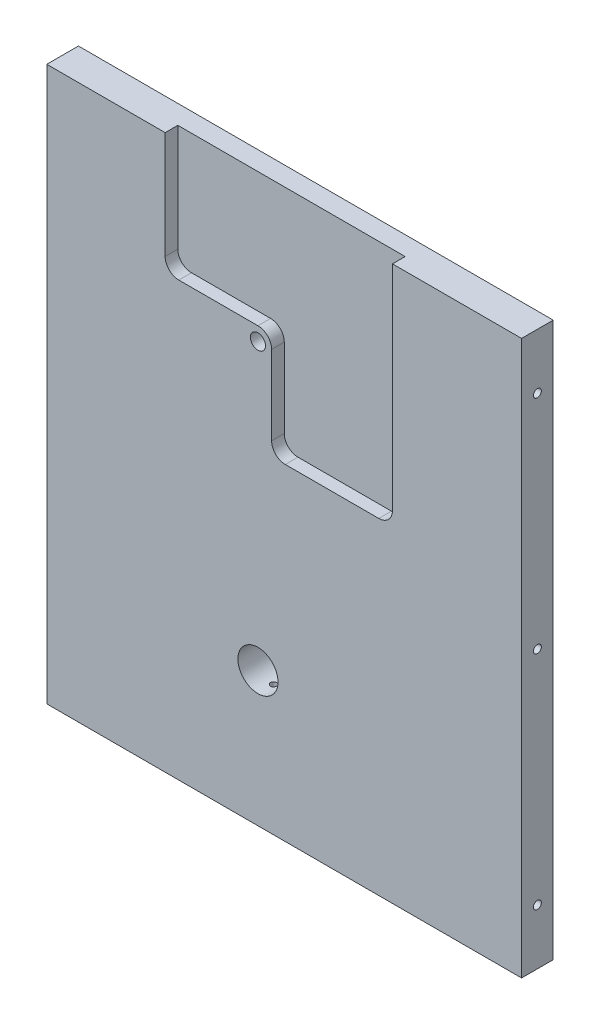
from build123d import *

# Parameters (mm, degrees)
SKIZZE1_W                       = 150
SKIZZE1_H                       = 175
AUFSATZ_LINEAR_AUSTRAGEN1_DEPTH = 10
SKIZZE2_R                       = 2.3876
SKIZZE2_R_2                     = 6.335
SCHNITT_LINEAR_AUSTRAGEN1_DEPTH = 10
SCHNITT_LINEAR_AUSTRAGEN2_DEPTH = 4
SKIZZE4_R                       = 1.25
SCHNITT_LINEAR_AUSTRAGEN3_DEPTH = 5
SCHNITT_LINEAR_START            = -5
SKIZZE6_R                       = 1.25
SCHNITT_LINEAR_AUSTRAGEN4_DEPTH = 5
SKIZZE7_R                       = 1
SCHNITT_LINEAR_AUSTRAGEN5_DEPTH = 40


with BuildPart() as part:
    # Skizze1 → Aufsatz-Linear austragen1 (new body)
    with BuildSketch(Plane.XY):
        with Locations((-21.140947697, -18.099765847)):
            Rectangle(SKIZZE1_W, SKIZZE1_H)
    extrude(amount=AUFSATZ_LINEAR_AUSTRAGEN1_DEPTH)

    # Skizze2 → Schnitt-Linear austragen1 (cut)
    with BuildSketch(Plane.XY.offset(10)):
        with Locations((-29.425704113, 26.900234153)):
            Circle(SKIZZE2_R)
        with Locations((-29.425704113, -63.099765847)):
            Circle(SKIZZE2_R_2)
    extrude(amount=-SCHNITT_LINEAR_AUSTRAGEN1_DEPTH, mode=Mode.SUBTRACT)

    # Skizze3 → Schnitt-Linear austragen2 (cut)
    with BuildSketch(Plane.XY.offset(10)):
        with BuildLine():
            Line((-54.425704113, 31.218234153), (-29.425704113, 31.218234153))
            ThreePointArc((-29.425704113, 31.218234153), (-26.372417032, 29.953521235), (-25.107704113, 26.900234153))
            Line((-25.107704113, 26.900234153), (-25.107704113, 1.900234153))
            ThreePointArc((-25.107704113, 1.900234153), (-23.842991195, -1.153052928), (-20.789704113, -2.417765847))
            Line((-20.789704113, -2.417765847), (8.756295887, -2.417765847))
            ThreePointArc((8.756295887, -2.417765847), (11.809582968, -1.153052928), (13.074295887, 1.900234153))
            Line((13.074295887, 1.900234153), (13.074295887, 69.400234153))
            Line((13.074295887, 69.400234153), (-58.743704113, 69.400234153))
            Line((-58.743704113, 69.400234153), (-58.743704113, 35.536234153))
            ThreePointArc((-58.743704113, 35.536234153), (-57.478991195, 32.482947072), (-54.425704113, 31.218234153))
        make_face()
    extrude(amount=-SCHNITT_LINEAR_AUSTRAGEN2_DEPTH, mode=Mode.SUBTRACT)

    # Skizze4 → Schnitt-Linear austragen3 (cut)
    with BuildSketch(Plane.ZY.offset(96.140947697)):
        with Locations((5, 51.900234153)):
            Circle(SKIZZE4_R)
        with Locations((5, -18.099765847)):
            Circle(SKIZZE4_R)
        with Locations((5, -88.099765847)):
            Circle(SKIZZE4_R)
    extrude(amount=-SCHNITT_LINEAR_AUSTRAGEN3_DEPTH, mode=Mode.SUBTRACT)

    # Skizze6 → Schnitt-Linear austragen4 (cut)
    with BuildSketch(Plane(origin=(53.859052303, 0, 0), x_dir=(0, 0, -1), z_dir=(1, 0, 0)).offset(SCHNITT_LINEAR_START)):
        with Locations((-5, 51.900234153)):
            Circle(SKIZZE6_R)
        with Locations((-5, -18.099765847)):
            Circle(SKIZZE6_R)
        with Locations((-5, -88.099765847)):
            Circle(SKIZZE6_R)
    extrude(amount=SCHNITT_LINEAR_AUSTRAGEN4_DEPTH, mode=Mode.SUBTRACT)

    # Skizze7 → Schnitt-Linear austragen5 (cut)
    with BuildSketch(Plane.XZ.offset(105.599765847)):
        with Locations((-29.420947697, 5)):
            Circle(SKIZZE7_R)
    extrude(amount=-SCHNITT_LINEAR_AUSTRAGEN5_DEPTH, mode=Mode.SUBTRACT)


solid = part.part
